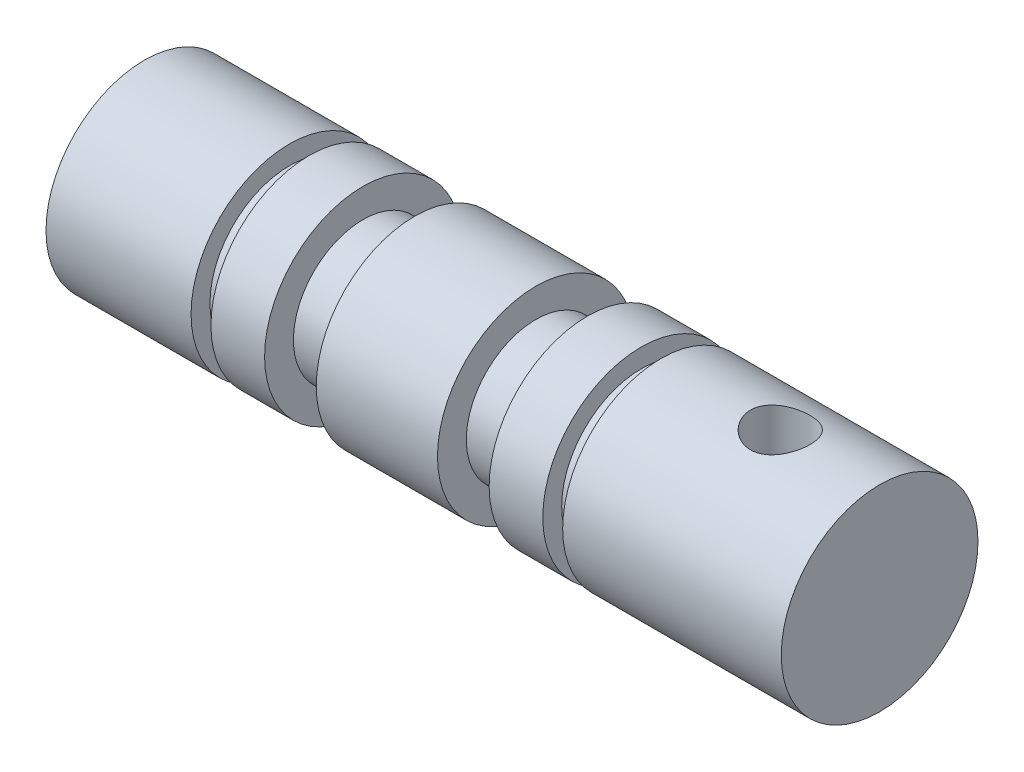
from build123d import *

# Parameters (mm, degrees)
SKETCH_1_R               = 4.95
EXTRUDE_1_DEPTH          = 37
CUT_EXTRUDE_START        = 11
SKETCH_1_3_R             = 4.95
SKETCH_1_3_R_2           = 3.5
CUT_EXTRUDE_1_DEPTH      = 2.6
CUT_EXTRUDE_START_2      = 19.7
SKETCH_1_4_R             = 4.95
SKETCH_1_4_R_2           = 3.5
CUT_EXTRUDE_2_DEPTH      = 2.6
SKETCH_2_R               = 1.5
CUT_EXTRUDE_3_DEPTH      = 10
SKETCH_3_R               = 1.25
CUT_EXTRUDE_4_DEPTH      = 38.656407157
CUT_EXTRUDE_START_3      = -7.3
SKETCH_4_R               = 4.95
SKETCH_4_R_2             = 4
CUT_EXTRUDE_5_DEPTH      = 1
CUT_EXTRUDE_START_4      = -25
SKETCH_4_2_R             = 4.95
SKETCH_4_2_R_2           = 4
CUT_EXTRUDE_6_DEPTH      = 1
CUT_EXTRUDE_7_DEPTH      = 38.656407184
CUT_EXTRUDE_7_DEPTH_BACK = 38.656407184
SKETCH_5_R               = 1.5


with BuildPart() as part:
    # Эскиз1 → Бобышка-Вытянуть1 (new body)
    with BuildSketch(Plane(origin=(0, 0, 0), x_dir=(0, 0, -1), z_dir=(1, 0, 0))):
        Circle(SKETCH_1_R)
    extrude(amount=EXTRUDE_1_DEPTH)

    # Эскиз1<3> → Вырез-Вытянуть1 (cut)
    with BuildSketch(Plane(origin=(0, 0, 0), x_dir=(0, 0, -1), z_dir=(1, 0, 0)).offset(CUT_EXTRUDE_START)):
        Circle(SKETCH_1_3_R)
        Circle(SKETCH_1_3_R_2, mode=Mode.SUBTRACT)
    extrude(amount=CUT_EXTRUDE_1_DEPTH, mode=Mode.SUBTRACT)

    # Эскиз1<4> → Вырез-Вытянуть2 (cut)
    with BuildSketch(Plane(origin=(0, 0, 0), x_dir=(0, 0, -1), z_dir=(1, 0, 0)).offset(CUT_EXTRUDE_START_2)):
        Circle(SKETCH_1_4_R)
        Circle(SKETCH_1_4_R_2, mode=Mode.SUBTRACT)
    extrude(amount=CUT_EXTRUDE_2_DEPTH, mode=Mode.SUBTRACT)

    # Эскиз2 → Вырез-Вытянуть3 (cut)
    with BuildSketch(Plane.ZY):
        Circle(SKETCH_2_R)
    extrude(amount=-CUT_EXTRUDE_3_DEPTH, mode=Mode.SUBTRACT)

    # Эскиз3 → Вырез-Вытянуть4 (cut, through all)
    with BuildSketch(Plane(origin=(0, 0, 0), x_dir=(1, 0, 0), z_dir=(0, 1, 0))):
        with Locations((4, 0)):
            Circle(SKETCH_3_R)
    extrude(amount=-CUT_EXTRUDE_4_DEPTH, mode=Mode.SUBTRACT)

    # Эскиз4 → Вырез-Вытянуть5 (cut)
    with BuildSketch(Plane.ZY.offset(CUT_EXTRUDE_START_3)):
        Circle(SKETCH_4_R)
        Circle(SKETCH_4_R_2, mode=Mode.SUBTRACT)
    extrude(amount=-CUT_EXTRUDE_5_DEPTH, mode=Mode.SUBTRACT)

    # Эскиз4<2> → Вырез-Вытянуть6 (cut)
    with BuildSketch(Plane.ZY.offset(CUT_EXTRUDE_START_4)):
        Circle(SKETCH_4_2_R)
        Circle(SKETCH_4_2_R_2, mode=Mode.SUBTRACT)
    extrude(amount=-CUT_EXTRUDE_6_DEPTH, mode=Mode.SUBTRACT)

    # Эскиз5 → Вырез-Вытянуть7 (cut, two sides: drawn at the far end of the back side and taken through both)
    with BuildSketch(Plane(origin=(0, 0, 0), x_dir=(1, 0, 0), z_dir=(0, 1, 0)).offset(-CUT_EXTRUDE_7_DEPTH_BACK)):
        with Locations((32, 0)):
            Circle(SKETCH_5_R)
    extrude(amount=CUT_EXTRUDE_7_DEPTH + CUT_EXTRUDE_7_DEPTH_BACK, mode=Mode.SUBTRACT)


solid = part.part
